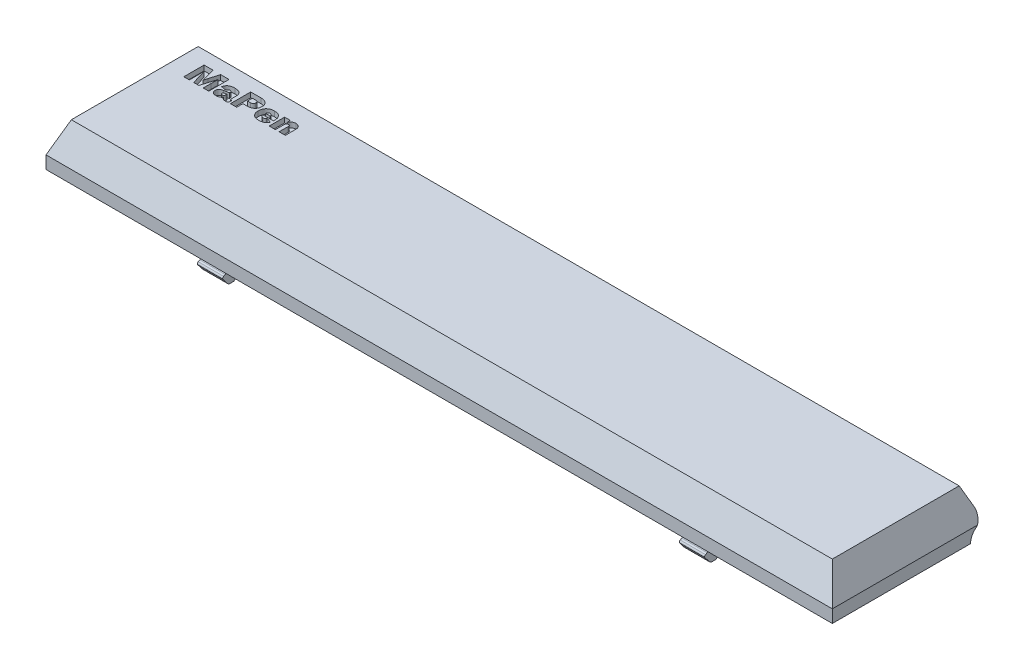
from build123d import *

# Parameters (mm, degrees)
SKETCH1_W           = 155
SKETCH1_H           = 30
BOSS_EXTRUDE1_DEPTH = 8.5
SKETCH2_R           = 2.5
BOSS_EXTRUDE2_DEPTH = 155
SKETCH3_R           = 2.75
CUT_EXTRUDE4_DEPTH  = 18.75
CUT_EXTRUDE5_START  = -24.25
SKETCH3_4_R         = 2.75
CUT_EXTRUDE5_DEPTH  = 12.5
CUT_EXTRUDE6_START  = -42.25
SKETCH3_5_R         = 2.75
CUT_EXTRUDE6_DEPTH  = 23.5
SKETCH4_R           = 2.75
CUT_EXTRUDE7_DEPTH  = 6.25
BOSS_EXTRUDE3_REACH = 121.84
SKETCH5_R           = 1
BOSS_EXTRUDE4_REACH = 87.98
SKETCH6_R           = 1
CUT_EXTRUDE14_DEPTH = 2
CUT_EXTRUDE10_DEPTH = 157.216196343
FILLET3_START       = -77.5
FILLET3_DEPTH       = 155
FILLET3_START_2     = -58.75
FILLET3_2_DEPTH     = 5.5
FILLET3_START_3     = -40.75
FILLET3_3_DEPTH     = 5.5
FILLET3_START_4     = -11.75
FILLET3_4_DEPTH     = 5.5
FILLET3_START_5     = 6.25
FILLET3_5_DEPTH     = 5.5
FILLET3_START_6     = 35.25
FILLET3_6_DEPTH     = 5.5
FILLET3_START_7     = 53.25
FILLET3_7_DEPTH     = 5.5
FILLET4_R           = 2.5
CUT_EXTRUDE11_DEPTH = 85.467449352
WRAP1_START         = -1
WRAP1_DEPTH         = 2
BOSS_EXTRUDE5_START = 45
BOSS_EXTRUDE5_DEPTH = 5


with BuildPart() as part:
    # Sketch1 → Boss-Extrude1 (new body)
    with BuildSketch(Plane(origin=(0, 0, 0), x_dir=(1, 0, 0), z_dir=(0, 1, 0))):
        Rectangle(SKETCH1_W, SKETCH1_H)
    extrude(amount=BOSS_EXTRUDE1_DEPTH)

    # Sketch2 → Boss-Extrude2 (add, through all)
    with BuildSketch(Plane(origin=(77.5, 0, 0), x_dir=(0, 0, -1), z_dir=(1, 0, 0))):
        with Locations((15, 0)):
            Circle(SKETCH2_R)
    extrude(amount=-BOSS_EXTRUDE2_DEPTH)

    # Sketch3 → Cut-Extrude4 (cut)
    with BuildSketch(Plane(origin=(77.5, 0, 0), x_dir=(0, 0, -1), z_dir=(1, 0, 0))):
        with Locations((15, 0)):
            Circle(SKETCH3_R)
    cut_extrude4 = extrude(amount=-CUT_EXTRUDE4_DEPTH, mode=Mode.SUBTRACT)

    # Sketch3<4> → Cut-Extrude5 (cut)
    with BuildSketch(Plane(origin=(77.5, 0, 0), x_dir=(0, 0, -1), z_dir=(1, 0, 0)).offset(CUT_EXTRUDE5_START)):
        with Locations((15, 0)):
            Circle(SKETCH3_4_R)
    cut_extrude5 = extrude(amount=-CUT_EXTRUDE5_DEPTH, mode=Mode.SUBTRACT)

    # Sketch3<5> → Cut-Extrude6 (cut)
    with BuildSketch(Plane(origin=(77.5, 0, 0), x_dir=(0, 0, -1), z_dir=(1, 0, 0)).offset(CUT_EXTRUDE6_START)):
        with Locations((15, 0)):
            Circle(SKETCH3_5_R)
    cut_extrude6 = extrude(amount=-CUT_EXTRUDE6_DEPTH, mode=Mode.SUBTRACT)

    # Mirror2: Cut-Extrude4, Cut-Extrude5, Cut-Extrude6 across plane
    add(cut_extrude4.mirror(Plane(origin=(0, 0, 0), x_dir=(0, 0, 1), z_dir=(1, 0, 0))), mode=Mode.SUBTRACT)
    add(cut_extrude5.mirror(Plane(origin=(0, 0, 0), x_dir=(0, 0, 1), z_dir=(1, 0, 0))), mode=Mode.SUBTRACT)
    add(cut_extrude6.mirror(Plane(origin=(0, 0, 0), x_dir=(0, 0, 1), z_dir=(1, 0, 0))), mode=Mode.SUBTRACT)

    # Sketch4 → Cut-Extrude7 (cut, symmetric)
    with BuildSketch(Plane(origin=(0, 0, 0), x_dir=(0, 0, -1), z_dir=(1, 0, 0))):
        with Locations((15, 0)):
            Circle(SKETCH4_R)
    extrude(amount=CUT_EXTRUDE7_DEPTH, both=True, mode=Mode.SUBTRACT)

    # Sketch5 → Boss-Extrude3 (add, up to next)
    with BuildSketch(Plane(origin=(40.75, 0, 0), x_dir=(0, 0, -1), z_dir=(1, 0, 0)), mode=Mode.PRIVATE) as boss_extrude3_sk1:
        with Locations((15, 0)):
            Circle(SKETCH5_R)
    boss_extrude3_tool1 = extrude(boss_extrude3_sk1.sketch, amount=BOSS_EXTRUDE3_REACH, mode=Mode.PRIVATE) - part.part
    boss_extrude3 = boss_extrude3_tool1.solids().sort_by_distance((40.75, 0, -15))[0]
    add(boss_extrude3)

    # Sketch6 → Boss-Extrude4 (add, up to next)
    with BuildSketch(Plane(origin=(-6.25, 0, 0), x_dir=(0, 0, -1), z_dir=(1, 0, 0)), mode=Mode.PRIVATE) as boss_extrude4_sk1:
        with Locations((15, 0)):
            Circle(SKETCH6_R)
    boss_extrude4_tool1 = extrude(boss_extrude4_sk1.sketch, amount=BOSS_EXTRUDE4_REACH, mode=Mode.PRIVATE) - part.part
    add(boss_extrude4_tool1.solids().sort_by_distance((-6.25, 0, -15))[0])

    # Mirror3: Boss-Extrude3 across plane
    add(boss_extrude3.mirror(Plane(origin=(0, 0, 0), x_dir=(0, 0, 1), z_dir=(1, 0, 0))))

    # Sketch7 → Cut-Revolve1 (revolve, cut)
    with BuildSketch(Plane(origin=(0, 0, 0), x_dir=(-1, 0, 0), z_dir=(0, -1, 0))):
        with BuildLine():
            Line((-71.4, 0), (-71.4, -5))
            Line((-71.4, -5), (55.466979459, -5))
            ThreePointArc((55.466979459, -5), (55.598838528, -4.991268473), (55.728394934, -4.965226372))
            Line((55.728394934, -4.965226372), (67.230707738, -1.850016654))
            ThreePointArc((67.230707738, -1.850016654), (67.497085551, -1.671250577), (67.6, -1.367403468))
            Line((67.6, -1.367403468), (67.6, -1.75))
            ThreePointArc((67.6, -1.75), (67.746446609, -1.396446609), (68.1, -1.25))
            Line((68.1, -1.25), (70.052734234, -1.25))
            ThreePointArc((70.052734234, -1.25), (70.532810427, -1.127226794), (70.895005634, -0.789053696))
            Line((70.895005634, -0.789053696), (71.4, 0))
            Line((71.4, 0), (-71.4, 0))
        make_face()
    revolve(axis=Axis((0, 0, 0), (1, 0, 0)), mode=Mode.SUBTRACT)

    # Sketch18 → Cut-Extrude14 (cut)
    with BuildSketch(Plane.XZ):
        with BuildLine():
            Line((72.4, 6), (-55.466979459, 6))
            ThreePointArc((-55.466979459, 6), (-55.730697596, 5.982536946), (-55.98981041, 5.930452744))
            Line((-55.98981041, 5.930452744), (-69.579174387, 2.25))
            Line((-69.579174387, 2.25), (-70.052734234, 2.25))
            ThreePointArc((-70.052734234, 2.25), (-71.012886621, 2.004453588), (-71.737277035, 1.328107393))
            Line((-71.737277035, 1.328107393), (-72.587265766, 0))
            Line((-72.587265766, 0), (-71.737277035, -1.328107393))
            ThreePointArc((-71.737277035, -1.328107393), (-71.012886621, -2.004453588), (-70.052734234, -2.25))
            Line((-70.052734234, -2.25), (-69.579174387, -2.25))
            Line((-69.579174387, -2.25), (-55.98981041, -5.930452744))
            ThreePointArc((-55.98981041, -5.930452744), (-55.730697596, -5.982536946), (-55.466979459, -6))
            Line((-55.466979459, -6), (72.4, -6))
            Line((72.4, -6), (72.4, 6))
        make_face()
    extrude(amount=-CUT_EXTRUDE14_DEPTH, mode=Mode.SUBTRACT)

    # Sketch12 → Cut-Extrude10 (cut, through all)
    with BuildSketch(Plane.ZY.offset(77.5)):
        Polygon((-15, 2.5), (-12.5, 8.5), (-15, 8.5), align=None)
        Polygon((15, 2.5), (15, 8.5), (12.5, 8.5), align=None)
    extrude(amount=-CUT_EXTRUDE10_DEPTH, mode=Mode.SUBTRACT)

    # Fillet3: read off the stored shape, not the designer's step
    # Fillet3 outline → Fillet3 (add)
    with BuildSketch(Plane.YZ.offset(FILLET3_START)):
        with BuildLine():
            ThreePointArc((2.742280325, -15.205909246), (3.178663795, -14.795056666), (3.700295214, -14.499876994))
            Line((3.700295214, -14.499876994), (2.748057007, -14.896642914))
            ThreePointArc((2.748057007, -14.896642914), (2.749520398, -15.051357365), (2.742280325, -15.205909246))
        make_face()
    extrude(amount=FILLET3_DEPTH)

    # Fillet3 2 outline → Fillet3 2 (add)
    with BuildSketch(Plane.YZ.offset(FILLET3_START_2)):
        with BuildLine():
            ThreePointArc((2.330916838, -15.903784651), (2.508143418, -15.538074018), (2.742280325, -15.205909246))
            ThreePointArc((2.742280325, -15.205909246), (2.749520398, -15.051357365), (2.748057007, -14.896642914))
            Line((2.748057007, -14.896642914), (2.5, -15))
            ThreePointArc((2.5, -15), (2.457365672, -15.45973248), (2.330916838, -15.903784651))
        make_face()
    extrude(amount=FILLET3_2_DEPTH)

    # Fillet3 3 outline → Fillet3 3 (add)
    with BuildSketch(Plane.YZ.offset(FILLET3_START_3)):
        with BuildLine():
            ThreePointArc((2.330916838, -15.903784651), (2.508143418, -15.538074018), (2.742280325, -15.205909246))
            ThreePointArc((2.742280325, -15.205909246), (2.749520398, -15.051357365), (2.748057007, -14.896642914))
            Line((2.748057007, -14.896642914), (2.5, -15))
            ThreePointArc((2.5, -15), (2.457365672, -15.45973248), (2.330916838, -15.903784651))
        make_face()
    extrude(amount=FILLET3_3_DEPTH)

    # Fillet3 4 outline → Fillet3 4 (add)
    with BuildSketch(Plane.YZ.offset(FILLET3_START_4)):
        with BuildLine():
            ThreePointArc((2.330916838, -15.903784651), (2.508143418, -15.538074018), (2.742280325, -15.205909246))
            ThreePointArc((2.742280325, -15.205909246), (2.749520398, -15.051357365), (2.748057007, -14.896642914))
            Line((2.748057007, -14.896642914), (2.5, -15))
            ThreePointArc((2.5, -15), (2.457365672, -15.45973248), (2.330916838, -15.903784651))
        make_face()
    extrude(amount=FILLET3_4_DEPTH)

    # Fillet3 5 outline → Fillet3 5 (add)
    with BuildSketch(Plane.YZ.offset(FILLET3_START_5)):
        with BuildLine():
            ThreePointArc((2.330916838, -15.903784651), (2.508143418, -15.538074018), (2.742280325, -15.205909246))
            ThreePointArc((2.742280325, -15.205909246), (2.749520398, -15.051357365), (2.748057007, -14.896642914))
            Line((2.748057007, -14.896642914), (2.5, -15))
            ThreePointArc((2.5, -15), (2.457365672, -15.45973248), (2.330916838, -15.903784651))
        make_face()
    extrude(amount=FILLET3_5_DEPTH)

    # Fillet3 6 outline → Fillet3 6 (add)
    with BuildSketch(Plane.YZ.offset(FILLET3_START_6)):
        with BuildLine():
            ThreePointArc((2.330916838, -15.903784651), (2.508143418, -15.538074018), (2.742280325, -15.205909246))
            ThreePointArc((2.742280325, -15.205909246), (2.749520398, -15.051357365), (2.748057007, -14.896642914))
            Line((2.748057007, -14.896642914), (2.5, -15))
            ThreePointArc((2.5, -15), (2.457365672, -15.45973248), (2.330916838, -15.903784651))
        make_face()
    extrude(amount=FILLET3_6_DEPTH)

    # Fillet3 7 outline → Fillet3 7 (add)
    with BuildSketch(Plane.YZ.offset(FILLET3_START_7)):
        with BuildLine():
            ThreePointArc((2.330916838, -15.903784651), (2.508143418, -15.538074018), (2.742280325, -15.205909246))
            ThreePointArc((2.742280325, -15.205909246), (2.749520398, -15.051357365), (2.748057007, -14.896642914))
            Line((2.748057007, -14.896642914), (2.5, -15))
            ThreePointArc((2.5, -15), (2.457365672, -15.45973248), (2.330916838, -15.903784651))
        make_face()
    extrude(amount=FILLET3_7_DEPTH)

    # Fillet4
    # the kernel refuses this fillet: 2.5 mm, written as the material it takes off along each edge
    with BuildSketch(Plane(origin=(-83.957409848, 2.742280325, -15.205909246), x_dir=(0, -0.303748912487628, 0.9527521178998152), z_dir=(1, 0, 0))) as fillet4_piece_1:
        with BuildLine():
            CenterArc((2.993876892, -2.318335165), FILLET4_R, 111.977013898, 72.959939735)
            Line((0.503151897, -2.533483941), (0.254079397, -2.554998819))
            ThreePointArc((0.254079397, -2.554998819), (0.132605243, -1.148722121), (-0.210904725, -0.134235603))
            Line((-0.210904725, -0.134235603), (0.093558648, 0.231833516))
            ThreePointArc((0.093558648, 0.231833516), (1.029145205, 0.050168666), (1.964731762, 0.231833516))
            Line((1.964731762, 0.231833516), (2.05829041, 0))
        make_face()
    extrude(amount=25.207409848, mode=Mode.SUBTRACT)
    with BuildSketch(Plane(origin=(-83.957409848, 2.742280325, -15.205909246), x_dir=(0, -0.303748912487628, 0.9527521178998152), z_dir=(1, 0, 0))) as fillet4_piece_2_section:
        with BuildLine():
            CenterArc((2.993876892, -2.318335165), FILLET4_R, 111.977013898, 72.959939735)
            Line((0.503151897, -2.533483941), (0.254079397, -2.554998819))
            ThreePointArc((0.254079397, -2.554998819), (0.132605243, -1.148722121), (-0.210904725, -0.134235603))
            Line((-0.210904725, -0.134235603), (0.093558648, 0.231833516))
            ThreePointArc((0.093558648, 0.231833516), (1.029145205, 0.050168666), (1.964731762, 0.231833516))
            Line((1.964731762, 0.231833516), (2.05829041, 0))
        make_face()
    fillet4_piece_2 = extrude(amount=31.664819697, mode=Mode.PRIVATE)
    fillet4_piece_2 = split(fillet4_piece_2, bisect_by=Plane(origin=(-53.25, 2.742280325, -15.205909246), z_dir=(1, 0, 0)), keep=Keep.TOP, mode=Mode.PRIVATE)
    add(fillet4_piece_2, mode=Mode.SUBTRACT)
    with BuildSketch(Plane(origin=(-59.707409848, 2.742280325, -15.205909246), x_dir=(0, 0.8753317516200332, 0.48352282738853675), z_dir=(1, 0, 0))) as fillet4_piece_3_section:
        with BuildLine():
            CenterArc((2.857120703, 2.484922145), FILLET4_R, 190.744187878, 72.959939735)
            Line((0.400947418, 2.018861209), (0.15533009, 1.972255115))
            ThreePointArc((0.15533009, 1.972255115), (0.151266088, 1.019203277), (-0.209167566, 0.13692673))
            Line((-0.209167566, 0.13692673), (0.09058068, -0.233013176))
            ThreePointArc((0.09058068, -0.233013176), (1.152547885, -0.093701835), (2.555548263, -0.248492215))
            Line((2.555548263, -0.248492215), (2.582963939, 0))
        make_face()
    fillet4_piece_3 = extrude(amount=18.957409848, mode=Mode.PRIVATE)
    fillet4_piece_3 = split(fillet4_piece_3, bisect_by=Plane(origin=(-58.75, 2.742280325, -15.205909246), z_dir=(-1, 0, 0)), keep=Keep.TOP, mode=Mode.PRIVATE)
    add(fillet4_piece_3, mode=Mode.SUBTRACT)
    with BuildSketch(Plane(origin=(-53.25, 2.742280325, -15.205909246), x_dir=(0, 0.8753317516200332, 0.48352282738853675), z_dir=(1, 0, 0)), Plane(origin=(-6.25, 2.742280325, -15.205909246), x_dir=(0, 0.8753317516200332, 0.48352282738853675), z_dir=(1, 0, 0)), Plane(origin=(40.75, 2.742280325, -15.205909246), x_dir=(0, 0.8753317516200332, 0.48352282738853675), z_dir=(1, 0, 0))) as fillet4_piece_4:
        with BuildLine():
            CenterArc((2.857120703, 2.484922145), FILLET4_R, 190.744187878, 72.959939735)
            Line((0.400947418, 2.018861209), (0.15533009, 1.972255115))
            ThreePointArc((0.15533009, 1.972255115), (0.151266088, 1.019203277), (-0.209167566, 0.13692673))
            Line((-0.209167566, 0.13692673), (0.09058068, -0.233013176))
            ThreePointArc((0.09058068, -0.233013176), (1.152547885, -0.093701835), (2.555548263, -0.248492215))
            Line((2.555548263, -0.248492215), (2.582963939, 0))
        make_face()
    extrude(amount=12.5, mode=Mode.SUBTRACT)
    with BuildSketch(Plane(origin=(-53.25, 2.742280325, -15.205909246), x_dir=(0, 0.8753317516200332, 0.48352282738853675), z_dir=(1, 0, 0))) as fillet4_piece_5_section:
        with BuildLine():
            CenterArc((2.857120703, 2.484922145), FILLET4_R, 190.744187878, 72.959939735)
            Line((0.400947418, 2.018861209), (0.15533009, 1.972255115))
            ThreePointArc((0.15533009, 1.972255115), (0.151266088, 1.019203277), (-0.209167566, 0.13692673))
            Line((-0.209167566, 0.13692673), (0.09058068, -0.233013176))
            ThreePointArc((0.09058068, -0.233013176), (1.152547885, -0.093701835), (2.555548263, -0.248492215))
            Line((2.555548263, -0.248492215), (2.582963939, 0))
        make_face()
    fillet4_piece_5 = extrude(amount=18.957409848, mode=Mode.PRIVATE)
    fillet4_piece_5 = split(fillet4_piece_5, bisect_by=Plane(origin=(-35.25, 2.742280325, -15.205909246), z_dir=(1, 0, 0)), keep=Keep.TOP, mode=Mode.PRIVATE)
    add(fillet4_piece_5, mode=Mode.SUBTRACT)
    with BuildSketch(Plane(origin=(-41.707409848, 2.742280325, -15.205909246), x_dir=(0, 0.8753317516200332, 0.48352282738853675), z_dir=(1, 0, 0))) as fillet4_piece_6_section:
        with BuildLine():
            CenterArc((2.857120703, 2.484922145), FILLET4_R, 190.744187878, 72.959939735)
            Line((0.400947418, 2.018861209), (0.15533009, 1.972255115))
            ThreePointArc((0.15533009, 1.972255115), (0.151266088, 1.019203277), (-0.209167566, 0.13692673))
            Line((-0.209167566, 0.13692673), (0.09058068, -0.233013176))
            ThreePointArc((0.09058068, -0.233013176), (1.152547885, -0.093701835), (2.555548263, -0.248492215))
            Line((2.555548263, -0.248492215), (2.582963939, 0))
        make_face()
    fillet4_piece_6 = extrude(amount=29.957409848, mode=Mode.PRIVATE)
    fillet4_piece_6 = split(fillet4_piece_6, bisect_by=Plane(origin=(-40.75, 2.742280325, -15.205909246), z_dir=(-1, 0, 0)), keep=Keep.TOP, mode=Mode.PRIVATE)
    add(fillet4_piece_6, mode=Mode.SUBTRACT)
    with BuildSketch(Plane(origin=(-35.25, 2.742280325, -15.205909246), x_dir=(0, 0.8753317516200332, 0.48352282738853675), z_dir=(1, 0, 0)), Plane(origin=(11.75, 2.742280325, -15.205909246), x_dir=(0, 0.8753317516200332, 0.48352282738853675), z_dir=(1, 0, 0))) as fillet4_piece_7:
        with BuildLine():
            CenterArc((2.857120703, 2.484922145), FILLET4_R, 190.744187878, 72.959939735)
            Line((0.400947418, 2.018861209), (0.15533009, 1.972255115))
            ThreePointArc((0.15533009, 1.972255115), (0.151266088, 1.019203277), (-0.209167566, 0.13692673))
            Line((-0.209167566, 0.13692673), (0.09058068, -0.233013176))
            ThreePointArc((0.09058068, -0.233013176), (1.152547885, -0.093701835), (2.555548263, -0.248492215))
            Line((2.555548263, -0.248492215), (2.582963939, 0))
        make_face()
    extrude(amount=23.5, mode=Mode.SUBTRACT)
    with BuildSketch(Plane(origin=(-35.25, 2.742280325, -15.205909246), x_dir=(0, 0.8753317516200332, 0.48352282738853675), z_dir=(1, 0, 0))) as fillet4_piece_8_section:
        with BuildLine():
            CenterArc((2.857120703, 2.484922145), FILLET4_R, 190.744187878, 72.959939735)
            Line((0.400947418, 2.018861209), (0.15533009, 1.972255115))
            ThreePointArc((0.15533009, 1.972255115), (0.151266088, 1.019203277), (-0.209167566, 0.13692673))
            Line((-0.209167566, 0.13692673), (0.09058068, -0.233013176))
            ThreePointArc((0.09058068, -0.233013176), (1.152547885, -0.093701835), (2.555548263, -0.248492215))
            Line((2.555548263, -0.248492215), (2.582963939, 0))
        make_face()
    fillet4_piece_8 = extrude(amount=29.957409848, mode=Mode.PRIVATE)
    fillet4_piece_8 = split(fillet4_piece_8, bisect_by=Plane(origin=(-6.25, 2.742280325, -15.205909246), z_dir=(1, 0, 0)), keep=Keep.TOP, mode=Mode.PRIVATE)
    add(fillet4_piece_8, mode=Mode.SUBTRACT)
    with BuildSketch(Plane(origin=(-12.707409848, 2.742280325, -15.205909246), x_dir=(0, 0.8753317516200332, 0.48352282738853675), z_dir=(1, 0, 0))) as fillet4_piece_9_section:
        with BuildLine():
            CenterArc((2.857120703, 2.484922145), FILLET4_R, 190.744187878, 72.959939735)
            Line((0.400947418, 2.018861209), (0.15533009, 1.972255115))
            ThreePointArc((0.15533009, 1.972255115), (0.151266088, 1.019203277), (-0.209167566, 0.13692673))
            Line((-0.209167566, 0.13692673), (0.09058068, -0.233013176))
            ThreePointArc((0.09058068, -0.233013176), (1.152547885, -0.093701835), (2.555548263, -0.248492215))
            Line((2.555548263, -0.248492215), (2.582963939, 0))
        make_face()
    fillet4_piece_9 = extrude(amount=18.957409848, mode=Mode.PRIVATE)
    fillet4_piece_9 = split(fillet4_piece_9, bisect_by=Plane(origin=(-11.75, 2.742280325, -15.205909246), z_dir=(-1, 0, 0)), keep=Keep.TOP, mode=Mode.PRIVATE)
    add(fillet4_piece_9, mode=Mode.SUBTRACT)
    with BuildSketch(Plane(origin=(-6.25, 2.742280325, -15.205909246), x_dir=(0, 0.8753317516200332, 0.48352282738853675), z_dir=(1, 0, 0))) as fillet4_piece_10_section:
        with BuildLine():
            CenterArc((2.857120703, 2.484922145), FILLET4_R, 190.744187878, 72.959939735)
            Line((0.400947418, 2.018861209), (0.15533009, 1.972255115))
            ThreePointArc((0.15533009, 1.972255115), (0.151266088, 1.019203277), (-0.209167566, 0.13692673))
            Line((-0.209167566, 0.13692673), (0.09058068, -0.233013176))
            ThreePointArc((0.09058068, -0.233013176), (1.152547885, -0.093701835), (2.555548263, -0.248492215))
            Line((2.555548263, -0.248492215), (2.582963939, 0))
        make_face()
    fillet4_piece_10 = extrude(amount=18.957409848, mode=Mode.PRIVATE)
    fillet4_piece_10 = split(fillet4_piece_10, bisect_by=Plane(origin=(11.75, 2.742280325, -15.205909246), z_dir=(1, 0, 0)), keep=Keep.TOP, mode=Mode.PRIVATE)
    add(fillet4_piece_10, mode=Mode.SUBTRACT)
    with BuildSketch(Plane(origin=(5.292590152, 2.742280325, -15.205909246), x_dir=(0, 0.8753317516200332, 0.48352282738853675), z_dir=(1, 0, 0))) as fillet4_piece_11_section:
        with BuildLine():
            CenterArc((2.857120703, 2.484922145), FILLET4_R, 190.744187878, 72.959939735)
            Line((0.400947418, 2.018861209), (0.15533009, 1.972255115))
            ThreePointArc((0.15533009, 1.972255115), (0.151266088, 1.019203277), (-0.209167566, 0.13692673))
            Line((-0.209167566, 0.13692673), (0.09058068, -0.233013176))
            ThreePointArc((0.09058068, -0.233013176), (1.152547885, -0.093701835), (2.555548263, -0.248492215))
            Line((2.555548263, -0.248492215), (2.582963939, 0))
        make_face()
    fillet4_piece_11 = extrude(amount=29.957409848, mode=Mode.PRIVATE)
    fillet4_piece_11 = split(fillet4_piece_11, bisect_by=Plane(origin=(6.25, 2.742280325, -15.205909246), z_dir=(-1, 0, 0)), keep=Keep.TOP, mode=Mode.PRIVATE)
    add(fillet4_piece_11, mode=Mode.SUBTRACT)
    with BuildSketch(Plane(origin=(11.75, 2.742280325, -15.205909246), x_dir=(0, 0.8753317516200332, 0.48352282738853675), z_dir=(1, 0, 0))) as fillet4_piece_12_section:
        with BuildLine():
            CenterArc((2.857120703, 2.484922145), FILLET4_R, 190.744187878, 72.959939735)
            Line((0.400947418, 2.018861209), (0.15533009, 1.972255115))
            ThreePointArc((0.15533009, 1.972255115), (0.151266088, 1.019203277), (-0.209167566, 0.13692673))
            Line((-0.209167566, 0.13692673), (0.09058068, -0.233013176))
            ThreePointArc((0.09058068, -0.233013176), (1.152547885, -0.093701835), (2.555548263, -0.248492215))
            Line((2.555548263, -0.248492215), (2.582963939, 0))
        make_face()
    fillet4_piece_12 = extrude(amount=29.957409848, mode=Mode.PRIVATE)
    fillet4_piece_12 = split(fillet4_piece_12, bisect_by=Plane(origin=(40.75, 2.742280325, -15.205909246), z_dir=(1, 0, 0)), keep=Keep.TOP, mode=Mode.PRIVATE)
    add(fillet4_piece_12, mode=Mode.SUBTRACT)
    with BuildSketch(Plane(origin=(34.292590152, 2.742280325, -15.205909246), x_dir=(0, 0.8753317516200332, 0.48352282738853675), z_dir=(1, 0, 0))) as fillet4_piece_13_section:
        with BuildLine():
            CenterArc((2.857120703, 2.484922145), FILLET4_R, 190.744187878, 72.959939735)
            Line((0.400947418, 2.018861209), (0.15533009, 1.972255115))
            ThreePointArc((0.15533009, 1.972255115), (0.151266088, 1.019203277), (-0.209167566, 0.13692673))
            Line((-0.209167566, 0.13692673), (0.09058068, -0.233013176))
            ThreePointArc((0.09058068, -0.233013176), (1.152547885, -0.093701835), (2.555548263, -0.248492215))
            Line((2.555548263, -0.248492215), (2.582963939, 0))
        make_face()
    fillet4_piece_13 = extrude(amount=18.957409848, mode=Mode.PRIVATE)
    fillet4_piece_13 = split(fillet4_piece_13, bisect_by=Plane(origin=(35.25, 2.742280325, -15.205909246), z_dir=(-1, 0, 0)), keep=Keep.TOP, mode=Mode.PRIVATE)
    add(fillet4_piece_13, mode=Mode.SUBTRACT)
    with BuildSketch(Plane(origin=(40.75, 2.742280325, -15.205909246), x_dir=(0, 0.8753317516200332, 0.48352282738853675), z_dir=(1, 0, 0))) as fillet4_piece_14_section:
        with BuildLine():
            CenterArc((2.857120703, 2.484922145), FILLET4_R, 190.744187878, 72.959939735)
            Line((0.400947418, 2.018861209), (0.15533009, 1.972255115))
            ThreePointArc((0.15533009, 1.972255115), (0.151266088, 1.019203277), (-0.209167566, 0.13692673))
            Line((-0.209167566, 0.13692673), (0.09058068, -0.233013176))
            ThreePointArc((0.09058068, -0.233013176), (1.152547885, -0.093701835), (2.555548263, -0.248492215))
            Line((2.555548263, -0.248492215), (2.582963939, 0))
        make_face()
    fillet4_piece_14 = extrude(amount=18.957409848, mode=Mode.PRIVATE)
    fillet4_piece_14 = split(fillet4_piece_14, bisect_by=Plane(origin=(58.75, 2.742280325, -15.205909246), z_dir=(1, 0, 0)), keep=Keep.TOP, mode=Mode.PRIVATE)
    add(fillet4_piece_14, mode=Mode.SUBTRACT)
    with BuildSketch(Plane(origin=(52.292590152, 2.742280325, -15.205909246), x_dir=(0, 0.8753317516200334, 0.48352282738853614), z_dir=(1, 0, 0))) as fillet4_piece_15_section:
        with BuildLine():
            CenterArc((2.857120703, 2.484922145), FILLET4_R, 190.744187878, 72.959939735)
            Line((0.400947418, 2.018861209), (0.15533009, 1.972255115))
            ThreePointArc((0.15533009, 1.972255115), (0.151266088, 1.019203277), (-0.209167566, 0.13692673))
            Line((-0.209167566, 0.13692673), (0.09058068, -0.233013176))
            ThreePointArc((0.09058068, -0.233013176), (1.152547885, -0.093701835), (2.555548263, -0.248492215))
            Line((2.555548263, -0.248492215), (2.582963939, 0))
        make_face()
    fillet4_piece_15 = extrude(amount=31.664819697, mode=Mode.PRIVATE)
    fillet4_piece_15 = split(fillet4_piece_15, bisect_by=Plane(origin=(53.25, 2.742280325, -15.205909246), z_dir=(-1, 0, 0)), keep=Keep.TOP, mode=Mode.PRIVATE)
    add(fillet4_piece_15, mode=Mode.SUBTRACT)
    with BuildSketch(Plane(origin=(58.75, 2.742280325, -15.205909246), x_dir=(0, 0.8753317516200334, 0.48352282738853614), z_dir=(1, 0, 0))) as fillet4_piece_16:
        with BuildLine():
            CenterArc((2.857120703, 2.484922145), FILLET4_R, 190.744187878, 72.959939735)
            Line((0.400947418, 2.018861209), (0.15533009, 1.972255115))
            ThreePointArc((0.15533009, 1.972255115), (0.151266088, 1.019203277), (-0.209167566, 0.13692673))
            Line((-0.209167566, 0.13692673), (0.09058068, -0.233013176))
            ThreePointArc((0.09058068, -0.233013176), (1.152547885, -0.093701835), (2.555548263, -0.248492215))
            Line((2.555548263, -0.248492215), (2.582963939, 0))
        make_face()
    extrude(amount=25.207409848, mode=Mode.SUBTRACT)

    # Sketch13 → Cut-Extrude11 (cut, through all)
    with BuildSketch(Plane.XY.offset(15)):
        Polygon((77.5, 2.5), (75, 8.5), (77.5, 8.5), align=None)
    cut_extrude11 = extrude(amount=-CUT_EXTRUDE11_DEPTH, mode=Mode.SUBTRACT)

    # Mirror4: Cut-Extrude11 across plane
    add(cut_extrude11.mirror(Plane(origin=(0, 0, 0), x_dir=(0, 0, 1), z_dir=(1, 0, 0))), mode=Mode.SUBTRACT)

    # Wrap1: read off the stored shape, not the designer's step
    # Wrap1 outline → Wrap1 (cut)
    # profile 1 of 5: a face of its own
    with BuildSketch(Plane(origin=(0, 8.5, 0), x_dir=(1, 0, 0), z_dir=(0, 1, 0)).offset(WRAP1_START)):
        with BuildLine():
            add(Edge.make_bspline(
                [(-52.47191326, 7.656601586), (-52.472997841, 7.694185466), (-52.47500651, 7.763791695), (-52.487435131, 7.859936052), (-52.512892423, 7.938035118), (-52.547474615, 8.000124669), (-52.593720813, 8.046314942), (-52.649829105, 8.078600633), (-52.71607239, 8.097208759), (-52.763164366, 8.099210603), (-52.787934387, 8.100263558)],
                knots=[0, 0, 0, 0, 0.180681781, 0.334626898, 0.463935014, 0.573246305, 0.672950353, 0.77404062, 0.881147087, 1, 1, 1, 1], degree=3))
            Line((-52.47191326, 7.656601586), (-52.47191326, 5.917164966))
            Line((-52.47191326, 5.917164966), (-51.242159739, 5.917164966))
            Line((-51.242159739, 5.917164966), (-51.242159739, 7.970862149))
            add(Edge.make_bspline(
                [(-52.240399176, 9.015756515), (-52.20252069, 9.014834331), (-52.128319585, 9.01302784), (-52.020032961, 9.001187624), (-51.918447035, 8.978952353), (-51.823389276, 8.948641376), (-51.733816207, 8.911549657), (-51.651785386, 8.863084705), (-51.575211393, 8.80757682), (-51.506042633, 8.742986062), (-51.442748456, 8.671779206), (-51.389266664, 8.592126127), (-51.344021006, 8.505453653), (-51.306213942, 8.412419499), (-51.276897434, 8.3118655), (-51.257375747, 8.204454826), (-51.244628232, 8.090004179), (-51.242999461, 8.011391406), (-51.242159739, 7.970862149)],
                knots=[0, 0, 0, 0, 0.06924063, 0.135637188, 0.198757656, 0.258974328, 0.317850403, 0.375529459, 0.432707602, 0.490399125, 0.548170373, 0.60648432, 0.665262594, 0.726615083, 0.789753778, 0.856340696, 0.925935638, 1, 1, 1, 1], degree=3))
            add(Edge.make_bspline(
                [(-53.287054105, 8.313291727), (-53.263294112, 8.36716159), (-53.217007228, 8.472105562), (-53.124072997, 8.61398276), (-53.014258325, 8.735852326), (-52.908538986, 8.820254543), (-52.817594237, 8.877733863), (-52.745107757, 8.914836267), (-52.668965149, 8.945588023), (-52.58976681, 8.970916701), (-52.507260708, 8.991743688), (-52.421192351, 9.005100262), (-52.331866298, 9.014584945), (-52.271235498, 9.015361544), (-52.240399176, 9.015756515)],
                knots=[0, 0, 0, 0, 0.130927877, 0.25506082, 0.37579078, 0.494766614, 0.554950111, 0.615144247, 0.675808146, 0.737587668, 0.800180633, 0.865057513, 0.93136937, 1, 1, 1, 1], degree=3))
            Line((-53.287054105, 8.313291727), (-53.316983683, 8.959418487))
            Line((-53.316983683, 8.959418487), (-54.424378049, 8.959418487))
            Line((-54.424378049, 8.959418487), (-54.424378049, 5.917164966))
            Line((-54.424378049, 5.917164966), (-53.19550481, 5.917164966))
            Line((-53.19550481, 5.917164966), (-53.19550481, 7.522798769))
            add(Edge.make_bspline(
                [(-52.787934387, 8.100263558), (-52.820149437, 8.098874786), (-52.881495716, 8.096230185), (-52.966862708, 8.067994491), (-53.039414349, 8.021720809), (-53.097532689, 7.955789295), (-53.143005161, 7.872569071), (-53.173396874, 7.771306264), (-53.192913202, 7.652951003), (-53.194603214, 7.568077474), (-53.19550481, 7.522798769)],
                knots=[0, 0, 0, 0, 0.11999026, 0.228494326, 0.331574399, 0.437908165, 0.553220341, 0.683228117, 0.831007135, 1, 1, 1, 1], degree=3))
        make_face()
    # profile 2 of 5: a face of its own
    with BuildSketch(Plane(origin=(0, 8.5, 0), x_dir=(1, 0, 0), z_dir=(0, 1, 0)).offset(WRAP1_START)):
        with BuildLine():
            add(Edge.make_bspline(
                [(-56.921737204, 7.212939614), (-56.91499028, 7.169555231), (-56.902361678, 7.0883502), (-56.867310497, 6.978122388), (-56.822119389, 6.887839236), (-56.763951373, 6.816885164), (-56.691114552, 6.767108334), (-56.607500896, 6.730031481), (-56.509850976, 6.709478477), (-56.440608918, 6.707132986), (-56.40413157, 6.70589736)],
                knots=[0, 0, 0, 0, 0.16137474, 0.30205433, 0.42375239, 0.531031703, 0.635586838, 0.745326489, 0.865835672, 1, 1, 1, 1], degree=3))
            Line((-56.921737204, 7.212939614), (-54.925258331, 7.212939614))
            add(Edge.make_bspline(
                [(-54.895328753, 7.586179051), (-54.895660923, 7.55037517), (-54.896298431, 7.481659444), (-54.901233204, 7.383514192), (-54.910688543, 7.294736303), (-54.920562344, 7.239303496), (-54.925258331, 7.212939614)],
                knots=[0, 0, 0, 0, 0.286408927, 0.549683363, 0.785829085, 1, 1, 1, 1], degree=3))
            add(Edge.make_bspline(
                [(-56.464871007, 9.015756515), (-56.424355635, 9.015388368), (-56.344984559, 9.014667153), (-56.228166849, 9.004895575), (-56.115767074, 8.992613857), (-56.007586204, 8.972992213), (-55.903904741, 8.947411101), (-55.804410352, 8.916902134), (-55.709610022, 8.880320407), (-55.619016186, 8.839494358), (-55.533594315, 8.79222568), (-55.452235825, 8.74190322), (-55.377679212, 8.684938617), (-55.307302845, 8.624821635), (-55.242270925, 8.560015452), (-55.182942252, 8.489619457), (-55.128568691, 8.415350868), (-55.07986262, 8.336390773), (-55.037067673, 8.253811587), (-54.999024503, 8.16802289), (-54.966143983, 8.079451792), (-54.940801348, 7.9868268), (-54.920751142, 7.89125564), (-54.905579828, 7.792266657), (-54.896639918, 7.690219969), (-54.895769023, 7.621114448), (-54.895328753, 7.586179051)],
                knots=[0, 0, 0, 0, 0.050623458, 0.09917318, 0.14643842, 0.191903588, 0.236467863, 0.279853009, 0.321877502, 0.363399693, 0.403938427, 0.443824913, 0.482847182, 0.521075483, 0.559456532, 0.597446592, 0.636032109, 0.674402643, 0.713279873, 0.752193413, 0.791642486, 0.831239599, 0.872095615, 0.913642094, 0.956342883, 1, 1, 1, 1], degree=3))
            add(Edge.make_bspline(
                [(-58.107476641, 7.438291727), (-58.106669368, 7.478505528), (-58.105082389, 7.557559949), (-58.096447599, 7.674295084), (-58.08099934, 7.78672685), (-58.057312576, 7.894622001), (-58.029928838, 7.998808198), (-57.994324687, 8.098359827), (-57.952998635, 8.19372024), (-57.905359786, 8.284657329), (-57.851687352, 8.370775074), (-57.792667259, 8.452082997), (-57.728140674, 8.527620182), (-57.65941666, 8.598983792), (-57.58400643, 8.663450853), (-57.505073479, 8.725210023), (-57.419247079, 8.779073439), (-57.329214033, 8.828918866), (-57.234210178, 8.872297889), (-57.135860041, 8.911746694), (-57.032712524, 8.942649206), (-56.927005293, 8.970645023), (-56.81653729, 8.990434567), (-56.702886316, 9.0054323), (-56.585030369, 9.014493958), (-56.505379713, 9.015330876), (-56.464871007, 9.015756515)],
                knots=[0, 0, 0, 0, 0.046851787, 0.092103724, 0.136289531, 0.178930332, 0.220724155, 0.261700558, 0.301963523, 0.341718288, 0.381178023, 0.420083052, 0.458644155, 0.496838357, 0.535363079, 0.574129698, 0.613482681, 0.653259485, 0.693942536, 0.735076905, 0.776595821, 0.819294132, 0.862405062, 0.90722238, 0.952815187, 1, 1, 1, 1], degree=3))
            add(Edge.make_bspline(
                [(-56.416455514, 5.860826938), (-56.481077784, 5.861746436), (-56.607138773, 5.863540135), (-56.790277594, 5.885094925), (-56.963238795, 5.915436262), (-57.124483325, 5.961790701), (-57.275764246, 6.019362937), (-57.414817587, 6.092523511), (-57.544970245, 6.175734605), (-57.661766344, 6.274164082), (-57.76719393, 6.38315787), (-57.857906263, 6.503962865), (-57.936516979, 6.633794043), (-57.998562913, 6.775286892), (-58.048591455, 6.926309784), (-58.081770203, 7.088261232), (-58.103827688, 7.259867312), (-58.106238957, 7.377772192), (-58.107476641, 7.438291727)],
                knots=[0, 0, 0, 0, 0.073805469, 0.143974985, 0.210465303, 0.274256158, 0.335404, 0.395092896, 0.453499382, 0.511586407, 0.569213847, 0.626418312, 0.683865977, 0.742254173, 0.802588495, 0.865328159, 0.930874132, 1, 1, 1, 1], degree=3))
            add(Edge.make_bspline(
                [(-54.95606819, 6.712059332), (-54.96591689, 6.678653752), (-54.985470749, 6.612329471), (-55.027122997, 6.51805329), (-55.078784281, 6.429932204), (-55.140060357, 6.348032422), (-55.209399369, 6.270772721), (-55.289857087, 6.201135832), (-55.378752002, 6.136800878), (-55.476613938, 6.079162648), (-55.580223172, 6.027779964), (-55.688911323, 5.983471907), (-55.8009253, 5.945789753), (-55.917141358, 5.91506024), (-56.036328696, 5.890002679), (-56.159953565, 5.873858805), (-56.286850683, 5.862750109), (-56.373003624, 5.861471709), (-56.416455514, 5.860826938)],
                knots=[0, 0, 0, 0, 0.057430801, 0.114024563, 0.169587531, 0.225665128, 0.282572934, 0.340564485, 0.400912187, 0.463448744, 0.527769171, 0.591617548, 0.657006454, 0.722669139, 0.789909265, 0.857846774, 0.928303941, 1, 1, 1, 1], degree=3))
            Line((-54.95606819, 6.712059332), (-55.941983683, 7.021918487))
            add(Edge.make_bspline(
                [(-56.40413157, 6.70589736), (-56.375617292, 6.707011766), (-56.320571722, 6.709163078), (-56.241773118, 6.722726834), (-56.170745171, 6.747445204), (-56.108641011, 6.783325519), (-56.053427015, 6.827859214), (-56.007590597, 6.883557323), (-55.969028469, 6.948564893), (-55.951198493, 6.99692515), (-55.941983683, 7.021918487)],
                knots=[0, 0, 0, 0, 0.141425119, 0.273015022, 0.394983818, 0.512306572, 0.627083784, 0.744838933, 0.868128775, 1, 1, 1, 1], degree=3))
        make_face()
        with BuildLine():
            add(Edge.make_bspline(
                [(-56.057300584, 7.719981867), (-56.062010896, 7.75565284), (-56.07091037, 7.82304815), (-56.096593448, 7.915841054), (-56.12915097, 7.995234174), (-56.173392295, 8.059839492), (-56.228045974, 8.111174008), (-56.296612512, 8.146152876), (-56.37676947, 8.167218949), (-56.434507975, 8.169491187), (-56.464871007, 8.170686093)],
                knots=[0, 0, 0, 0, 0.157747958, 0.298042682, 0.421495117, 0.532600218, 0.639249084, 0.746981178, 0.866944626, 1, 1, 1, 1], degree=3))
            Line((-56.057300584, 7.719981867), (-56.921737204, 7.719981867))
            add(Edge.make_bspline(
                [(-56.464871007, 8.170686093), (-56.496709658, 8.169861656), (-56.557017457, 8.168300033), (-56.641490477, 8.147010893), (-56.715773912, 8.115018181), (-56.778149474, 8.066596179), (-56.830302672, 8.003433655), (-56.869450255, 7.923096167), (-56.902943084, 7.827848625), (-56.915196376, 7.757522217), (-56.921737204, 7.719981867)],
                knots=[0, 0, 0, 0, 0.132874823, 0.251687428, 0.362136837, 0.468957819, 0.578839396, 0.701840948, 0.840842215, 1, 1, 1, 1], degree=3))
        make_face(mode=Mode.SUBTRACT)
    # profile 3 of 5: a face of its own
    with BuildSketch(Plane(origin=(0, 8.5, 0), x_dir=(1, 0, 0), z_dir=(0, 1, 0)).offset(WRAP1_START)):
        with BuildLine():
            add(Edge.make_bspline(
                [(-58.449906218, 8.536883276), (-58.450842296, 8.483108524), (-58.452665369, 8.378378766), (-58.473945452, 8.22643269), (-58.505668913, 8.083329205), (-58.552671755, 7.950375799), (-58.611761967, 7.826132662), (-58.685777617, 7.712470733), (-58.771018727, 7.606430503), (-58.871385718, 7.512580643), (-58.982927142, 7.428475465), (-59.105915011, 7.355111421), (-59.240333477, 7.29360118), (-59.385802173, 7.243561509), (-59.542106765, 7.203867564), (-59.70966316, 7.176264363), (-59.888222964, 7.159191934), (-60.010898816, 7.157481664), (-60.074025936, 7.156601586)],
                knots=[0, 0, 0, 0, 0.06652919, 0.129569838, 0.18958285, 0.247719291, 0.303775452, 0.359501035, 0.415273964, 0.471808364, 0.529134418, 0.587947938, 0.648740954, 0.711815088, 0.778161527, 0.848157175, 0.921864002, 1, 1, 1, 1], degree=3))
            add(Edge.make_bspline(
                [(-60.074025936, 9.917164966), (-60.010898791, 9.916284922), (-59.888222889, 9.914574719), (-59.709663434, 9.897501817), (-59.542105815, 9.869900277), (-59.38580545, 9.830200593), (-59.24032207, 9.78018086), (-59.105955384, 9.718600312), (-58.982630513, 9.645395752), (-58.871629104, 9.560256137), (-58.771297766, 9.466539788), (-58.685500298, 9.361224789), (-58.611803292, 9.247601599), (-58.552660209, 9.123399775), (-58.505672161, 8.990434809), (-58.473944527, 8.847334585), (-58.45266562, 8.695387589), (-58.450842382, 8.590657962), (-58.449906218, 8.536883276)],
                knots=[0, 0, 0, 0, 0.078140817, 0.151852191, 0.221852156, 0.288202687, 0.351280712, 0.412077477, 0.470894624, 0.528443664, 0.584981551, 0.640476791, 0.696205811, 0.75226543, 0.810405457, 0.87042217, 0.933466707, 1, 1, 1, 1], degree=3))
            Line((-60.074025936, 9.917164966), (-62.069624528, 9.917164966))
            Line((-62.069624528, 9.917164966), (-62.069624528, 5.917164966))
            Line((-62.069624528, 5.917164966), (-60.828427345, 5.917164966))
            Line((-60.828427345, 5.917164966), (-60.828427345, 7.156601586))
            Line((-60.828427345, 7.156601586), (-60.074025936, 7.156601586))
        make_face()
        with BuildLine():
            add(Edge.make_bspline(
                [(-59.697265373, 8.536883276), (-59.69860283, 8.574656392), (-59.701130808, 8.646052761), (-59.729429395, 8.745601625), (-59.77421126, 8.831217395), (-59.840572145, 8.899765951), (-59.923658276, 8.953964474), (-60.025684229, 8.989558698), (-60.144258406, 9.013015514), (-60.229408569, 9.014804382), (-60.274730162, 9.015756515)],
                knots=[0, 0, 0, 0, 0.131760057, 0.249044575, 0.358795586, 0.466233545, 0.578952807, 0.702670014, 0.841744652, 1, 1, 1, 1], degree=3))
            add(Edge.make_bspline(
                [(-60.274730162, 8.058010036), (-60.229455316, 8.059498264), (-60.144462462, 8.06229206), (-60.025289601, 8.083525785), (-59.92422117, 8.121190574), (-59.839916186, 8.173767339), (-59.774841946, 8.243358356), (-59.728941328, 8.328493741), (-59.701395708, 8.428100661), (-59.698687341, 8.499432222), (-59.697265373, 8.536883276)],
                knots=[0, 0, 0, 0, 0.158394486, 0.297348328, 0.421491527, 0.533711984, 0.641953685, 0.75086054, 0.869194853, 1, 1, 1, 1], degree=3))
            Line((-60.274730162, 8.058010036), (-60.828427345, 8.058010036))
            Line((-60.828427345, 8.058010036), (-60.828427345, 9.015756515))
            Line((-60.828427345, 9.015756515), (-60.274730162, 9.015756515))
        make_face(mode=Mode.SUBTRACT)
    # profile 4 of 5: a face of its own
    with BuildSketch(Plane(origin=(0, 8.5, 0), x_dir=(1, 0, 0), z_dir=(0, 1, 0)).offset(WRAP1_START)):
        with BuildLine():
            add(Edge.make_bspline(
                [(-62.498321711, 5.963819896), (-62.534061407, 5.947902376), (-62.607113765, 5.915366779), (-62.726598734, 5.883600595), (-62.855341311, 5.863896083), (-62.944547085, 5.861868911), (-62.990399176, 5.860826938)],
                knots=[0, 0, 0, 0, 0.2311808, 0.47253627, 0.728881736, 1, 1, 1, 1], degree=3))
            Line((-62.498321711, 5.963819896), (-62.436701993, 6.61698891))
            add(Edge.make_bspline(
                [(-62.57050481, 6.593221304), (-62.544990895, 6.593805671), (-62.499084705, 6.594857099), (-62.455889849, 6.610181543), (-62.436701993, 6.61698891)],
                knots=[0, 0, 0, 0, 0.555783764, 1, 1, 1, 1], degree=3))
            add(Edge.make_bspline(
                [(-62.802018894, 6.836179051), (-62.801409324, 6.817063651), (-62.800263679, 6.781137536), (-62.790143773, 6.730742893), (-62.771218251, 6.688273216), (-62.745510098, 6.652840835), (-62.711568438, 6.625799933), (-62.671071626, 6.606172823), (-62.623060809, 6.594666994), (-62.588763867, 6.593723567), (-62.57050481, 6.593221304)],
                knots=[0, 0, 0, 0, 0.149058028, 0.280144585, 0.397971409, 0.509211461, 0.618239571, 0.732888912, 0.857794993, 1, 1, 1, 1], degree=3))
            Line((-62.802018894, 6.836179051), (-62.802018894, 7.856425529))
            add(Edge.make_bspline(
                [(-64.280892133, 9.015756515), (-64.222756003, 9.015128942), (-64.109796989, 9.013909562), (-63.945773404, 8.998272768), (-63.792271569, 8.974806709), (-63.648827807, 8.942996977), (-63.51652852, 8.899424805), (-63.394135347, 8.847834391), (-63.282513905, 8.785966585), (-63.181659872, 8.714675654), (-63.092689502, 8.634114764), (-63.014151206, 8.546777794), (-62.948735057, 8.450609265), (-62.894449692, 8.347100653), (-62.85326808, 8.235110382), (-62.823199493, 8.115664273), (-62.80561653, 7.988401941), (-62.803236183, 7.901080804), (-62.802018894, 7.856425529)],
                knots=[0, 0, 0, 0, 0.081794456, 0.158927347, 0.231644374, 0.300268535, 0.365435672, 0.427415826, 0.486941074, 0.544693651, 0.600836537, 0.655537747, 0.709603923, 0.764094278, 0.819630906, 0.877123028, 0.937161779, 1, 1, 1, 1], degree=3))
            add(Edge.make_bspline(
                [(-65.819624528, 7.941812853), (-65.813732499, 7.983056658), (-65.802209315, 8.06371816), (-65.770649045, 8.180148106), (-65.729282822, 8.289480144), (-65.67822471, 8.392500555), (-65.615816796, 8.488146158), (-65.543831878, 8.577563177), (-65.459872555, 8.658514984), (-65.367426604, 8.733963551), (-65.26444641, 8.800706234), (-65.151201491, 8.858064239), (-65.029124088, 8.907486317), (-64.89710689, 8.94636257), (-64.756732283, 8.978695373), (-64.606537947, 8.999913242), (-64.446929586, 9.013442237), (-64.337259718, 9.014970847), (-64.280892133, 9.015756515)],
                knots=[0, 0, 0, 0, 0.060081148, 0.117502148, 0.173658425, 0.228579637, 0.283081297, 0.338173668, 0.393873024, 0.45108126, 0.510163142, 0.570579148, 0.634039575, 0.699952104, 0.768988816, 0.841753739, 0.918665357, 1, 1, 1, 1], degree=3))
            Line((-65.819624528, 7.941812853), (-64.780011852, 7.759594543))
            add(Edge.make_bspline(
                [(-64.365399176, 8.170686093), (-64.392466707, 8.169406161), (-64.444799364, 8.166931526), (-64.51972393, 8.150709716), (-64.586175182, 8.120862121), (-64.645310711, 8.079821117), (-64.695012812, 8.023309208), (-64.733899899, 7.950082121), (-64.763330906, 7.86074145), (-64.774218383, 7.794723935), (-64.780011852, 7.759594543)],
                knots=[0, 0, 0, 0, 0.124516138, 0.240740847, 0.350086543, 0.457550593, 0.56939933, 0.692614216, 0.836433175, 1, 1, 1, 1], degree=3))
            add(Edge.make_bspline(
                [(-64.019448472, 7.793045248), (-64.020148436, 7.821050361), (-64.021483352, 7.874459481), (-64.040123136, 7.949547154), (-64.067356817, 8.016358258), (-64.109110246, 8.071564306), (-64.159700698, 8.116539436), (-64.220205303, 8.148898565), (-64.29006393, 8.167628969), (-64.339458197, 8.169633401), (-64.365399176, 8.170686093)],
                knots=[0, 0, 0, 0, 0.144372174, 0.275335104, 0.397614169, 0.514703833, 0.629702177, 0.745060016, 0.866110115, 1, 1, 1, 1], degree=3))
            Line((-64.019448472, 7.793045248), (-64.019448472, 7.69533398))
            Line((-64.019448472, 7.69533398), (-65.022969598, 7.48670722))
            add(Edge.make_bspline(
                [(-65.850434387, 6.664524121), (-65.849727842, 6.691259247), (-65.848341088, 6.74373297), (-65.838368918, 6.820282802), (-65.823008853, 6.893716399), (-65.798631141, 6.962556134), (-65.770154738, 7.028648314), (-65.732958683, 7.089616097), (-65.691258068, 7.148214416), (-65.64112834, 7.20172599), (-65.585748042, 7.25255155), (-65.522722701, 7.297658212), (-65.454892301, 7.340435831), (-65.380560853, 7.378194805), (-65.299804618, 7.411633847), (-65.213072306, 7.441289887), (-65.120228543, 7.467127287), (-65.055927444, 7.480072227), (-65.022969598, 7.48670722)],
                knots=[0, 0, 0, 0, 0.06252799, 0.122725301, 0.180355069, 0.237665057, 0.293285096, 0.34838163, 0.404402654, 0.461246178, 0.519566829, 0.579979027, 0.642265391, 0.707043891, 0.774739224, 0.84659468, 0.921371346, 1, 1, 1, 1], degree=3))
            add(Edge.make_bspline(
                [(-64.840751288, 5.860826938), (-64.879207167, 5.861560986), (-64.954189952, 5.862992261), (-65.063381351, 5.872403092), (-65.165962263, 5.88936991), (-65.262415493, 5.911818427), (-65.352167645, 5.941847687), (-65.435838793, 5.977851322), (-65.512534677, 6.021369074), (-65.58328208, 6.070215798), (-65.645894982, 6.126075376), (-65.701064296, 6.186811351), (-65.747019667, 6.253651206), (-65.78535215, 6.325222789), (-65.814376655, 6.402872383), (-65.835430584, 6.485484327), (-65.847837371, 6.573482625), (-65.849554389, 6.63367473), (-65.850434387, 6.664524121)],
                knots=[0, 0, 0, 0, 0.079021689, 0.154079599, 0.22495239, 0.292516428, 0.357342778, 0.419175532, 0.479378822, 0.538257192, 0.595488681, 0.651419102, 0.706445246, 0.761738309, 0.81784071, 0.876335018, 0.936619773, 1, 1, 1, 1], degree=3))
            add(Edge.make_bspline(
                [(-63.854835795, 6.332657924), (-63.876792854, 6.297678512), (-63.921209541, 6.226919052), (-64.012472415, 6.136027717), (-64.119552538, 6.054232052), (-64.244463755, 5.986272879), (-64.380837911, 5.9295791), (-64.527479303, 5.890801689), (-64.681376657, 5.864806878), (-64.786942851, 5.862170655), (-64.840751288, 5.860826938)],
                knots=[0, 0, 0, 0, 0.108165835, 0.218807455, 0.33595766, 0.461194803, 0.591150035, 0.722961443, 0.858789908, 1, 1, 1, 1], degree=3))
            add(Edge.make_bspline(
                [(-62.990399176, 5.860826938), (-63.043315522, 5.861887425), (-63.145288612, 5.863931049), (-63.291684378, 5.88770635), (-63.425881041, 5.924090014), (-63.547125424, 5.97550078), (-63.653071169, 6.0423516), (-63.741450201, 6.12441445), (-63.809954795, 6.22232575), (-63.839758026, 6.295591836), (-63.854835795, 6.332657924)],
                knots=[0, 0, 0, 0, 0.150440887, 0.289908946, 0.420773869, 0.545319897, 0.663214731, 0.77544756, 0.886396544, 1, 1, 1, 1], degree=3))
        make_face()
        with BuildLine():
            add(Edge.make_bspline(
                [(-64.377723119, 7.110826938), (-64.401640297, 7.104891109), (-64.44667075, 7.093715331), (-64.508079334, 7.070105867), (-64.558889752, 7.041701498), (-64.6009161, 7.009991069), (-64.632485813, 6.972315012), (-64.654312347, 6.928918722), (-64.66763204, 6.880392633), (-64.669181015, 6.845948582), (-64.669976641, 6.828256515)],
                knots=[0, 0, 0, 0, 0.165724149, 0.312019818, 0.441085786, 0.556417782, 0.664364205, 0.768561849, 0.881122599, 1, 1, 1, 1], degree=3))
            Line((-64.377723119, 7.110826938), (-64.019448472, 7.187411445))
            Line((-64.019448472, 7.187411445), (-64.019448472, 6.969981867))
            add(Edge.make_bspline(
                [(-64.390047063, 6.593221304), (-64.364687613, 6.594316375), (-64.315303311, 6.596448886), (-64.244865956, 6.61560096), (-64.180827411, 6.646008722), (-64.123806389, 6.688405982), (-64.076922761, 6.743270506), (-64.042316718, 6.809590917), (-64.023541312, 6.8868161), (-64.020853955, 6.941422699), (-64.019448472, 6.969981867)],
                knots=[0, 0, 0, 0, 0.127505406, 0.248300552, 0.364629284, 0.482847999, 0.603380733, 0.724995633, 0.856173135, 1, 1, 1, 1], degree=3))
            add(Edge.make_bspline(
                [(-64.669976641, 6.828256515), (-64.669404022, 6.811371993), (-64.668293412, 6.778623996), (-64.651752661, 6.732935343), (-64.629156896, 6.690843594), (-64.594904512, 6.655869935), (-64.5530371, 6.62738128), (-64.50419419, 6.607196402), (-64.448949957, 6.595850886), (-64.410347575, 6.594127573), (-64.390047063, 6.593221304)],
                knots=[0, 0, 0, 0, 0.122520394, 0.237631697, 0.350774454, 0.468912932, 0.590663753, 0.718315793, 0.85186578, 1, 1, 1, 1], degree=3))
        make_face(mode=Mode.SUBTRACT)
    # profile 5 of 5: a face of its own
    with BuildSketch(Plane(origin=(0, 8.5, 0), x_dir=(1, 0, 0), z_dir=(0, 1, 0)).offset(WRAP1_START)):
        Polygon((-70.163814669, 8.771038205), (-69.294096359, 5.917164966), (-68.295856922, 5.917164966), (-67.413814669, 8.771038205), (-67.401490725, 8.771038205), (-67.426138612, 7.496390318), (-67.426138612, 5.917164966), (-66.33106819, 5.917164966), (-66.33106819, 9.917164966), (-68.003603401, 9.917164966), (-68.545856922, 8.008714262), (-68.746561148, 7.209418487), (-68.75800481, 7.209418487), (-68.959589317, 8.008714262), (-69.500962556, 9.917164966), (-71.252723119, 9.917164966), (-71.252723119, 5.917164966), (-70.157652697, 5.917164966), (-70.157652697, 7.496390318), (-70.182300584, 8.771038205), align=None)
    extrude(amount=WRAP1_DEPTH, mode=Mode.SUBTRACT)

    # Sketch19 → Boss-Extrude5 (add)
    with BuildSketch(Plane(origin=(0, 0, 26.259739235), x_dir=(0, 0, 1), z_dir=(-1, 0, 0)).offset(BOSS_EXTRUDE5_START)):
        with BuildLine():
            Line((-16.059739235, 0), (-16.059739235, -4.7))
            ThreePointArc((-16.059739235, -4.7), (-15.942581947, -4.982842712), (-15.659739235, -5.1))
            Line((-15.659739235, -5.1), (-15.077733821, -5.1))
            ThreePointArc((-15.077733821, -5.1), (-14.768940761, -5.028209238), (-14.523486242, -4.827562418))
            Line((-14.523486242, -4.827562418), (-13.651560349, -3.697288113))
            ThreePointArc((-13.651560349, -3.697288113), (-13.597268046, -3.444498433), (-13.759739235, -3.243368153))
            Line((-13.759739235, -3.243368153), (-14.059739235, -3.1))
            Line((-14.059739235, -3.1), (-14.089860953, -3.085605016))
            ThreePointArc((-14.089860953, -3.085605016), (-14.219837546, -2.965746233), (-14.259739235, -2.793502517))
            Line((-14.259739235, -2.793502517), (-14.059739235, 0))
            Line((-14.059739235, 0), (-16.059739235, 0))
        make_face()
    boss_extrude5 = extrude(amount=BOSS_EXTRUDE5_DEPTH)

    # Mirror5: Boss-Extrude5 across plane
    add(boss_extrude5.mirror(Plane(origin=(0, 0, 0), x_dir=(0, 0, 1), z_dir=(1, 0, 0))))


solid = part.part
